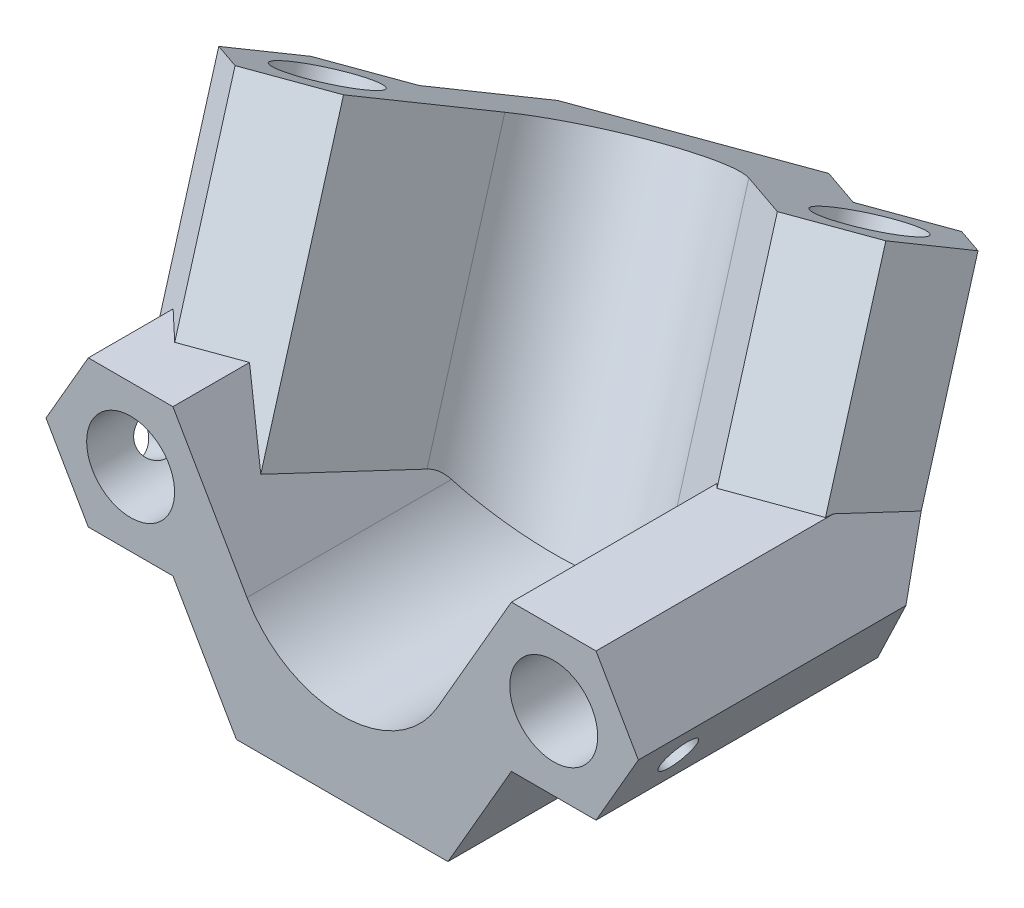
from build123d import *
from build123d.topology import SkipClean

# Parameters (mm, degrees)
SKETCH3_R                      = 3.6
BOSS_EXTRUDE1_DEPTH            = 15
BOSS_EXTRUDE6_REACH            = 51.045
SKETCH11_R                     = 3.6
SKETCH11_R_2                   = 3.5
CUT_EXTRUDE5_START             = -15
SKETCH22_R                     = 3.6
CUT_EXTRUDE5_DEPTH             = 15
CUT_EXTRUDE6_DEPTH             = 42.269694796
CUT_EXTRUDE6_DEPTH_BACK        = 42.269694796
SKETCH23_W                     = 48.497422612
SKETCH23_H                     = 6.75711345
CUT_EXTRUDE7_DEPTH             = 52.625225339
CUT_EXTRUDE7_DEPTH_BACK        = 52.625225339
BOSS_EXTRUDE7_REACH            = 43.27
CUT_EXTRUDE8_DEPTH             = 50.044816065
CUT_EXTRUDE8_DEPTH_BACK        = 50.044816065
CUT_EXTRUDE9_REACH             = 59.915
CUT_EXTRUDE9_END_RADIUS        = 3.6
SKETCH27_R                     = 1.5
CUT_EXTRUDE9_DIRECTION_2_DEPTH = 58.914901556
CUT_EXTRUDE10_REACH            = 61.364
CUT_EXTRUDE10_END_RADIUS       = 3.6
SKETCH28_R                     = 1.5
CUT_EXTRUDE11_REACH            = 57.894
CUT_EXTRUDE11_END_RADIUS       = 3.5
SKETCH29_R                     = 1.5
CUT_EXTRUDE12_REACH            = 58.167
CUT_EXTRUDE12_END_RADIUS       = 3.6
SKETCH30_R                     = 1.5
BOSS_EXTRUDE8_DEPTH            = 7
SKETCH32_R                     = 1.25
CUT_EXTRUDE13_DEPTH            = 44.02231395
CUT_EXTRUDE16_REACH            = 45.022


with BuildPart() as part:
    # Sketch3 → Boss-Extrude1 (new body)
    with BuildSketch(Plane.XY):
        with BuildLine():
            Line((-13.856406461, -6), (-8.660254038, -15))
            Line((-8.660254038, -15), (8.660254038, -15))
            Line((8.660254038, -15), (13.856406461, -6))
            Line((13.856406461, -6), (20.784609691, -6))
            Line((20.784609691, -6), (24.248711306, 0))
            Line((24.248711306, 0), (20.784609691, 6))
            Line((20.784609691, 6), (13.856406461, 6))
            Line((13.856406461, 6), (7.794228634, -4.5))
            ThreePointArc((7.794228634, -4.5), (0, -9), (-7.794228634, -4.5))
            Line((-7.794228634, -4.5), (-13.856406461, 6))
            Line((-13.856406461, 6), (-20.784609691, 6))
            Line((-20.784609691, 6), (-24.248711306, 0))
            Line((-24.248711306, 0), (-20.784609691, -6))
            Line((-20.784609691, -6), (-13.856406461, -6))
        make_face()
        with Locations((17.320508076, 0)):
            Circle(SKETCH3_R, mode=Mode.SUBTRACT)
        with Locations(Location((-17.320508076, 0, 0), (0, 0, 180))):
            Circle(SKETCH3_R, mode=Mode.SUBTRACT)
    extrude(amount=BOSS_EXTRUDE1_DEPTH)

    # Boss-Extrude6: up to this plane
    boss_extrude6_end = Plane(origin=(-8.660254038, -15, 15), z_dir=(0, 1, 0))
    # Sketch11 → Boss-Extrude6 (add, up to the surface)
    with BuildSketch(Plane(origin=(-3.420201433, 17.320508076, -9.396926208), x_dir=(-0.9848548662958843, -0.16407968211983687, 0.05602455041113298), z_dir=(0.17101007166283289, -0.8660254037844364, 0.4698463103929591)), mode=Mode.PRIVATE) as boss_extrude6_sk1:
        with BuildLine():
            Line((13.103060202, 11.327392168), (-3.258279275, 17.011279087))
            Line((-3.258279275, 17.011279087), (-11.120115397, 10.214843786))
            Line((-11.120115397, 10.214843786), (-17.664651188, 12.488398553))
            Line((-17.664651188, 12.488398553), (-22.905875269, 7.957441686))
            Line((-22.905875269, 7.957441686), (-21.602563558, 1.152930051))
            Line((-21.602563558, 1.152930051), (-15.058027767, -1.120624716))
            Line((-15.058027767, -1.120624716), (-5.885885626, 6.808549802))
            ThreePointArc((-5.885885626, 6.808549802), (2.953434278, 8.501601376), (8.839319904, 1.693051575))
            Line((8.839319904, 1.693051575), (11.120115397, -10.214843786))
            Line((11.120115397, -10.214843786), (17.664651188, -12.488398553))
            Line((17.664651188, -12.488398553), (22.905875269, -7.957441686))
            Line((22.905875269, -7.957441686), (21.602563558, -1.152930051))
            Line((21.602563558, -1.152930051), (15.058027767, 1.120624716))
            Line((15.058027767, 1.120624716), (13.103060202, 11.327392168))
        make_face()
        with Locations(Location((-16.361339478, 5.683886918, 0), (0, 0, 70.842905587))):
            Circle(SKETCH11_R, mode=Mode.SUBTRACT)
        with Locations(Location((16.361339478, -5.683886918, 0), (0, 0, 253.389591115))):
            Circle(SKETCH11_R_2, mode=Mode.SUBTRACT)
    boss_extrude6_tool1 = split(extrude(boss_extrude6_sk1.sketch, amount=BOSS_EXTRUDE6_REACH, mode=Mode.PRIVATE), bisect_by=boss_extrude6_end, keep=Keep.BOTH, mode=Mode.PRIVATE)
    add(boss_extrude6_tool1.solids().sort_by_distance((-7.701781, 10.092948, -21.160469))[0])

    # Sketch22 → Cut-Extrude5 (cut)
    with BuildSketch(Plane.XY.offset(15).offset(CUT_EXTRUDE5_START)):
        with Locations(Location((-17.320508076, 0, 0), (0, 0, 173.920998641))):
            Circle(SKETCH22_R)
        with Locations(Location((17.320508076, 0, 0), (0, 0, 168.152765972))):
            Circle(SKETCH22_R)
    extrude(amount=CUT_EXTRUDE5_DEPTH, mode=Mode.SUBTRACT)

    # Sketch23 → Cut-Extrude6 (cut, two sides: drawn at the far end of the back side and taken through both)
    with BuildSketch(Plane(origin=(0, 0, 0), x_dir=(1, 0, 0), z_dir=(0, 1, 0)).offset(-CUT_EXTRUDE6_DEPTH_BACK)):
        with Locations((0, -18.378556725)):
            Rectangle(SKETCH23_W, SKETCH23_H)
    extrude(amount=CUT_EXTRUDE6_DEPTH + CUT_EXTRUDE6_DEPTH_BACK, mode=Mode.SUBTRACT)

    # Sketch24 → Cut-Extrude7 (cut, two sides: drawn at the far end of the back side and taken through both)
    with SkipClean():  # the faces are left unmerged after this step: merging them gives an invalid solid
        with BuildSketch(Plane.XY.offset(15).offset(-CUT_EXTRUDE7_DEPTH_BACK)):
            Polygon((-24.248711306, 0), (-20.784609691, -6), (-13.856406461, -6), (-8.660254038, -15), (-19.659605529, -15), align=None)
            Polygon((8.660254038, -15), (13.856406461, -6), (20.784609691, -6), (24.248711306, 0), (25.748316405, -15), align=None)
        extrude(amount=CUT_EXTRUDE7_DEPTH + CUT_EXTRUDE7_DEPTH_BACK, mode=Mode.SUBTRACT)

    # Boss-Extrude7: up to this plane
    with SkipClean():  # the faces are left unmerged after this step: merging them gives an invalid solid
        boss_extrude7_end = Plane(origin=(-0.099408044, -70.708741287, 25.047767507), z_dir=(0.2961981327260181, 0.5000000000000041, 0.8137976813493734))
        # Sketch25 → Boss-Extrude7 (add, up to the surface)
        with BuildSketch(Plane(origin=(0, 0, 0), x_dir=(-1, 0, 0), z_dir=(0, 0, -1)), mode=Mode.PRIVATE) as boss_extrude7_sk1:
            with BuildLine():
                Line((-7.794228634, -4.5), (-13.856406461, 6))
                Line((-13.856406461, 6), (-20.784609691, 6))
                Line((-20.784609691, 6), (-24.248711306, 0))
                Line((-24.248711306, 0), (-20.784609691, -6))
                Line((-20.784609691, -6), (-13.856406461, -6))
                Line((-13.856406461, -6), (-8.660254038, -15))
                Line((-8.660254038, -15), (8.660254038, -15))
                Line((8.660254038, -15), (13.856406461, -6))
                Line((13.856406461, -6), (20.784609691, -6))
                Line((20.784609691, -6), (24.248711306, 0))
                Line((24.248711306, 0), (20.784609691, 6))
                Line((20.784609691, 6), (13.856406461, 6))
                Line((13.856406461, 6), (7.794228634, -4.5))
                ThreePointArc((7.794228634, -4.5), (0, -9), (-7.794228634, -4.5))
            make_face()
        boss_extrude7_tool1 = split(extrude(boss_extrude7_sk1.sketch, amount=BOSS_EXTRUDE7_REACH, mode=Mode.PRIVATE), bisect_by=boss_extrude7_end, keep=Keep.BOTH, mode=Mode.PRIVATE)
        add(boss_extrude7_tool1.solids().sort_by_distance((0, -9.528488, 0))[0])

    # Sketch26 → Cut-Extrude8 (cut, two sides: drawn at the far end of the back side and taken through both)
    with BuildSketch(Plane(origin=(-3.420201433, 17.320508076, -9.396926208), x_dir=(0.9852692806486321, 0.15031328924160944, -0.08154973750721406), z_dir=(-0.17101007166283294, 0.8660254037844365, -0.46984631039295904)).offset(-CUT_EXTRUDE8_DEPTH_BACK)):
        Polygon((-12.769046038, 11.702626341), (-15.019195248, 1.556847488), (-24.009999606, -1.277121199), (-23.108119871, 8.443673045), align=None)
        Polygon((3.750248683, 16.909631422), (11.411676306, 9.888055617), (18.019394195, 11.970857649), (24.454933942, 6.072788464), (26.114385656, 23.958974435), align=None)
    extrude(amount=CUT_EXTRUDE8_DEPTH + CUT_EXTRUDE8_DEPTH_BACK, mode=Mode.SUBTRACT)

    # Cut-Extrude9: up to this cylinder (the profile starts outside it)
    cut_extrude9_end = Plane(origin=(-17.320508076, 0, 10), z_dir=(0, 0, -1)) * Cylinder(CUT_EXTRUDE9_END_RADIUS, 128.03, mode=Mode.PRIVATE)
    # Sketch27 → Cut-Extrude9 (cut, up to the surface)
    with BuildSketch(Plane(origin=(-18.186533479, -10.5, 0), x_dir=(0, 0, 1), z_dir=(-0.866025403784431, -0.5000000000000133, 0)), mode=Mode.PRIVATE) as cut_extrude9_sk1:
        with Locations(Location((10, 8.660254038, 0), (0, 0, 270))):
            Circle(SKETCH27_R)
    cut_extrude9_tool1 = extrude(cut_extrude9_sk1.sketch, amount=-CUT_EXTRUDE9_REACH, mode=Mode.PRIVATE) - cut_extrude9_end
    add(cut_extrude9_tool1.solids().sort_by_distance((-22.51666, -3, 10))[0], mode=Mode.SUBTRACT)

    # Sketch27 → Cut-Extrude9 direction 2 (cut)
    with BuildSketch(Plane(origin=(-18.186533479, -10.5, 0), x_dir=(0, 0, 1), z_dir=(-0.866025403784431, -0.5000000000000133, 0))):
        with Locations(Location((10, 8.660254038, 0), (0, 0, 270))):
            Circle(SKETCH27_R)
    extrude(amount=CUT_EXTRUDE9_DIRECTION_2_DEPTH, mode=Mode.SUBTRACT)

    # Cut-Extrude10: up to this cylinder (the profile starts outside it)
    cut_extrude10_end = Plane(origin=(17.320508076, 0, 10), z_dir=(0, 0, -1)) * Cylinder(CUT_EXTRUDE10_END_RADIUS, 130.928, mode=Mode.PRIVATE)
    # Sketch28 → Cut-Extrude10 (cut, up to the surface)
    with BuildSketch(Plane(origin=(18.186533479, -10.5, 0), x_dir=(0, 0, -1), z_dir=(0.8660254037844384, -0.5000000000000004, 0)), mode=Mode.PRIVATE) as cut_extrude10_sk1:
        with Locations(Location((-10, 8.660254038, 0), (0, 0, 90))):
            Circle(SKETCH28_R)
    cut_extrude10_tool1 = extrude(cut_extrude10_sk1.sketch, amount=-CUT_EXTRUDE10_REACH, mode=Mode.PRIVATE) - cut_extrude10_end
    add(cut_extrude10_tool1.solids().sort_by_distance((22.51666, -3, 10))[0], mode=Mode.SUBTRACT)

    # Cut-Extrude11: up to this cylinder (the profile starts outside it)
    cut_extrude11_end = Plane(origin=(-18.841104668, 12.990380885, -1.123731908), z_dir=(-0.17101007166283286, 0.8660254037844364, -0.46984631039295904)) * Cylinder(CUT_EXTRUDE11_END_RADIUS, 123.788, mode=Mode.PRIVATE)
    # Sketch29 → Cut-Extrude11 (cut, up to the surface)
    with BuildSketch(Plane(origin=(-20.199831702, -5.25, -2.324714867), x_dir=(-0.10714116317598177, -0.02784632639386428, 0.993853788672994), z_dir=(-0.9618967477123848, -0.2500000000000016, -0.11070070794866659)), mode=Mode.PRIVATE) as cut_extrude11_sk1:
        with Locations(Location((0.540098175, 17.3120852, 0), (0, 0, 270))):
            Circle(SKETCH29_R)
    cut_extrude11_tool1 = extrude(cut_extrude11_sk1.sketch, amount=-CUT_EXTRUDE11_REACH, mode=Mode.PRIVATE) - cut_extrude11_end
    add(cut_extrude11_tool1.solids().sort_by_distance((-24.612485, 11.490381, -1.787936))[0], mode=Mode.SUBTRACT)

    # Cut-Extrude12: up to this cylinder (the profile starts outside it)
    cut_extrude12_end = Plane(origin=(13.710802565, 12.990380989, -12.971657273), z_dir=(-0.17101007166283286, 0.8660254037844364, -0.46984631039295904)) * Cylinder(CUT_EXTRUDE12_END_RADIUS, 124.534, mode=Mode.PRIVATE)
    # Sketch30 → Cut-Extrude12 (cut, up to the surface)
    with BuildSketch(Plane(origin=(13.979670915, -5.25, -14.765036441), x_dir=(-0.746220714001717, -0.22302336376340517, -0.6272282082387747), z_dir=(0.6656986149863674, -0.25000000000000144, -0.703096973400705)), mode=Mode.PRIVATE) as cut_extrude12_sk1:
        with Locations(Location((-4.992253977, 16.585457492, 0), (0, 0, 13.316944925))):
            Circle(SKETCH30_R)
    cut_extrude12_tool1 = extrude(cut_extrude12_sk1.sketch, amount=-CUT_EXTRUDE12_REACH, mode=Mode.PRIVATE) - cut_extrude12_end
    add(cut_extrude12_tool1.solids().sort_by_distance((17.704994, 11.490381, -17.190239))[0], mode=Mode.SUBTRACT)

    # Sketch31 → Boss-Extrude8 (add)
    with BuildSketch(Plane(origin=(-4.442971991, -7.5, -12.20696522), x_dir=(-0.955126518409797, 0.15505701444619335, 0.25237007766653485), z_dir=(-0.29619813272601814, -0.5000000000000043, -0.8137976813493732))):
        Polygon((-1.206291552, 7.334497985), (0.226063792, 15.205225916), (5.145268749, 14.310003826), (3.712913405, 6.439275895), align=None)
    extrude(amount=BOSS_EXTRUDE8_DEPTH)

    # Sketch32 → Cut-Extrude13 (cut, through all)
    with BuildSketch(Plane(origin=(2.349231552, 0, -0.855050358), x_dir=(-0.3420201433256627, 0, -0.9396926207859106), z_dir=(0.9396926207859105, 0, -0.34202014332566266))):
        with Locations((22.387495374, -0.223720558)):
            Circle(SKETCH32_R)
    extrude(amount=-CUT_EXTRUDE13_DEPTH, mode=Mode.SUBTRACT)

    # Sketch34 → Cut-Extrude16 (cut, up to next)
    with BuildSketch(Plane(origin=(2.349231552, 0, -0.855050358), x_dir=(-0.34202014332566316, 0, -0.9396926207859104), z_dir=(0.9396926207859104, 0, -0.34202014332566316)), mode=Mode.PRIVATE) as cut_extrude16_sk1:
        with BuildLine():
            Line((26.552558883, 1.990381057), (24.387495374, 3.240381057))
            Line((24.387495374, 3.240381057), (20.490381057, 5.490381057))
            Line((20.490381057, 5.490381057), (23.512495374, 1.7248366))
            ThreePointArc((23.512495374, 1.7248366), (24.336052532, -1.348720558), (21.262495374, -2.172277717))
            Line((21.262495374, -2.172277717), (16.490381057, -1.437822174))
            Line((16.490381057, -1.437822174), (20.387495374, -3.687822174))
            Line((20.387495374, -3.687822174), (22.552558883, -4.937822174))
            Line((22.552558883, -4.937822174), (26.552558883, 1.990381057))
        make_face()
    cut_extrude16_tool1 = extrude(cut_extrude16_sk1.sketch, amount=-CUT_EXTRUDE16_REACH, mode=Mode.PRIVATE) & part.part
    add(cut_extrude16_tool1.solids().sort_by_distance((-4.099351, -1.948276, -18.572386))[0], mode=Mode.SUBTRACT)


solid = part.part
